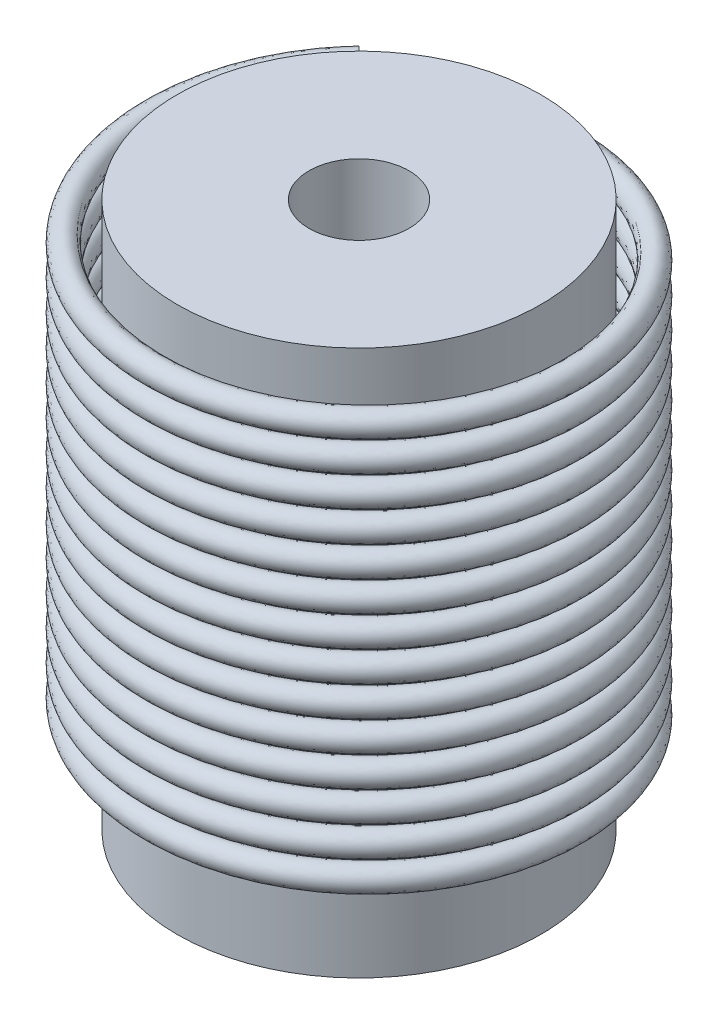
from build123d import *

# Parameters (mm, degrees)
EXTRUDE_2_DEPTH      = 16
EXTRUDE_2_DEPTH_BACK = 2
SKETCH_1_R           = 6
SWEEP_2_PITCH        = 1


with BuildPart() as part:
    # 草图1 → 凸台-拉伸2 (new, two sides: drawn at the far end of the back side and taken through both)
    with BuildSketch(Plane(origin=(0, 0, 0), x_dir=(1, 0, 0), z_dir=(0, 1, 0)).offset(-EXTRUDE_2_DEPTH_BACK)):
        with Locations(Location((0, 0, 0), (0, 0, 270))):
            Circle(SKETCH_1_R)
    extrude(amount=EXTRUDE_2_DEPTH + EXTRUDE_2_DEPTH_BACK)

    # 草图6 → M4 螺纹孔1 (revolve, cut)
    with BuildSketch(Plane(origin=(0, 16, 0), x_dir=(0, 0, 1), z_dir=(1, 0, 0))):
        Polygon((0, 0), (0, 12.491420021), (1.65, 11.5), (1.65, 0), align=None)
    revolve(axis=Axis((0, 22.35, 0), (0, -1, 0)), mode=Mode.SUBTRACT)


with BuildPart() as body_2:
    # 扫描2: arcs per turn and ends read off the stored shape
    # 扫描2: the profile of 草图5 screwed along a left-hand helix through 14.125019 turns, 8 arcs to a turn; built about Z, then put on its axis
    sweep_2_z = Axis((0, 0, 0), (0, 0, 1))
    sweep_2_corners = [(4.595267108, 4.596430192, 0.894836551), (4.878074028, 4.879308692, 1.294836551), (5.160880948, 5.162187192, 0.894836551), (4.878074028, 4.879308692, 0.494836551)]
    with BuildLine(mode=Mode.PRIVATE) as sweep_2_profile:
        ThreePointArc((4.595267108, 4.596430192, 0.894836551), (4.678099337, 4.679283386, 1.177679264), (4.878074028, 4.879308692, 1.294836551))
        ThreePointArc((4.878074028, 4.879308692, 1.294836551), (5.078048719, 5.079333997, 1.177679264), (5.160880948, 5.162187192, 0.894836551))
        ThreePointArc((5.160880948, 5.162187192, 0.894836551), (5.078048719, 5.079333997, 0.611993839), (4.878074028, 4.879308692, 0.494836551))
        ThreePointArc((4.878074028, 4.879308692, 0.494836551), (4.678099337, 4.679283386, 0.611993839), (4.595267108, 4.596430192, 0.894836551))
    sweep_2_cap = Face(sweep_2_profile.wire())
    sweep_2_arcs = [((4.595267108, 4.596430192, 0.894836551), (4.595267108, 4.596430192, 1.294836551), (4.878074028, 4.879308692, 1.294836551), (1, 0.7071067811865475, 1)), ((4.878074028, 4.879308692, 1.294836551), (5.160880948, 5.162187192, 1.294836551), (5.160880948, 5.162187192, 0.894836551), (1, 0.7071067811865475, 1)), ((5.160880948, 5.162187192, 0.894836551), (5.160880948, 5.162187192, 0.494836551), (4.878074028, 4.879308692, 0.494836551), (1, 0.7071067811865475, 1)), ((4.878074028, 4.879308692, 0.494836551), (4.595267108, 4.596430192, 0.494836551), (4.595267108, 4.596430192, 0.894836551), (1, 0.7071067811865475, 1))]  # start, shoulder, end, weights
    sweep_2_turn_angles = [0, -22.5, -45, -67.5, -90, -112.5, -135, -157.5, -180, -202.5, -225, -247.5, -270, -292.5, -315, -337.5, -360]
    sweep_2_turn_weights = [1, 0.9238795325112867, 1, 0.9238795325112867, 1, 0.9238795325112867, 1, 0.9238795325112867, 1, 0.9238795325112867, 1, 0.9238795325112867, 1, 0.9238795325112867, 1, 0.9238795325112867, 1]
    sweep_2_turn_sides = [Face.make_bezier_surface([[Vector(p[j][0], p[j][1], 0).rotate(sweep_2_z, sweep_2_turn_angles[2 * i + k]) / sweep_2_turn_weights[2 * i + k] + Vector(0, 0, p[j][2] + -SWEEP_2_PITCH * sweep_2_turn_angles[2 * i + k] / 360) for k in range(3)] for j in range(3)], [[p[3][j] * sweep_2_turn_weights[2 * i + k] for k in range(3)] for j in range(3)]) for p in sweep_2_arcs for i in range(8)]
    sweep_2_last_angles = [-5040, -5062.5, -5085, -5085.0035, -5085.007]
    sweep_2_last_weights = [1, 0.9238795325112867, 1, 0.9999999981342184, 1]
    sweep_2_last_sides = [Face.make_bezier_surface([[Vector(p[j][0], p[j][1], 0).rotate(sweep_2_z, sweep_2_last_angles[2 * i + k]) / sweep_2_last_weights[2 * i + k] + Vector(0, 0, p[j][2] + -SWEEP_2_PITCH * sweep_2_last_angles[2 * i + k] / 360) for k in range(3)] for j in range(3)], [[p[3][j] * sweep_2_last_weights[2 * i + k] for k in range(3)] for j in range(3)]) for p in sweep_2_arcs for i in range(2)]
    sweep_2 = Plane(origin=(0, 0, 0), x_dir=(-0.7071067811865537, 0, -0.7071067811865414), z_dir=(0, 1, 0)) * Solid(Shell([*[p.moved(Location((0, 0, SWEEP_2_PITCH * i))) for i in range(14) for p in sweep_2_turn_sides], *sweep_2_last_sides, sweep_2_cap, sweep_2_cap.rotate(sweep_2_z, -5085.007).moved(Location((0, 0, -SWEEP_2_PITCH * -5085.007 / 360)))]))
    add(sweep_2)


solid = Compound([part.part, body_2.part])
